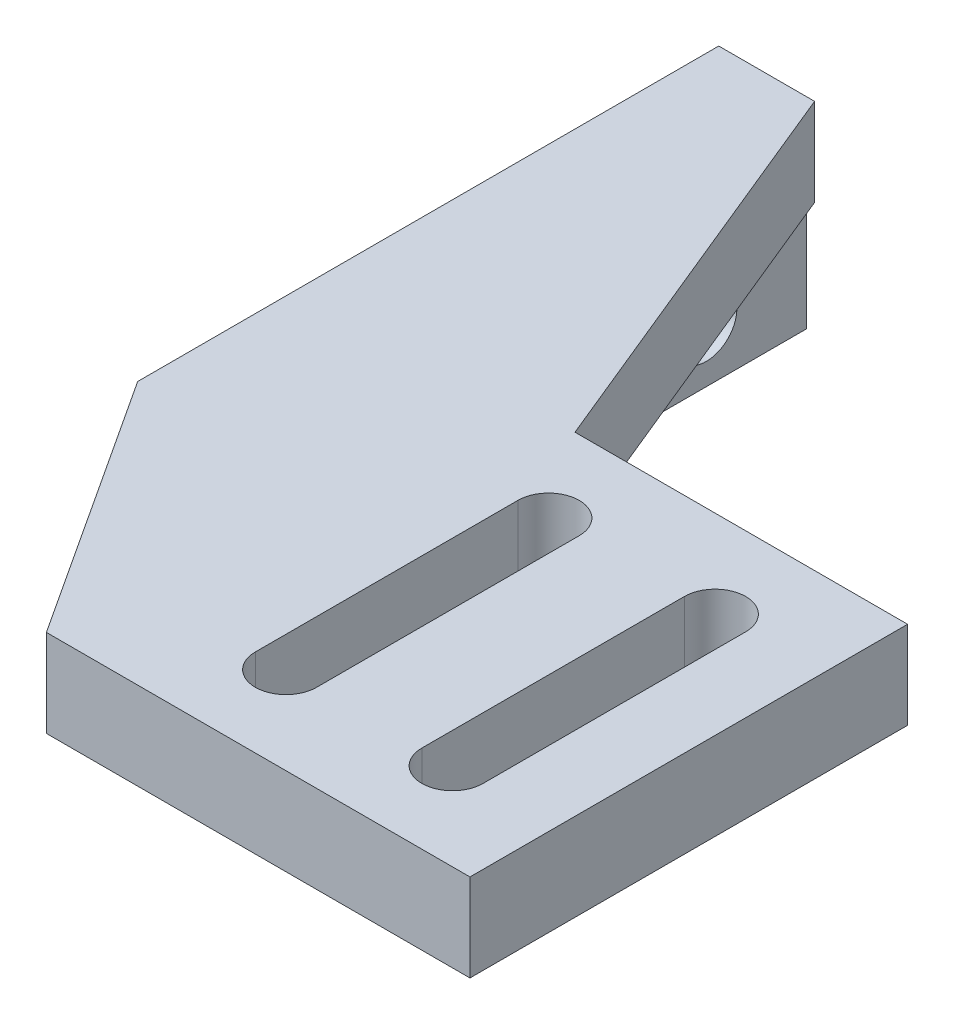
from build123d import *

# Parameters (mm, degrees)
ESTRUSIONE_ESTRUSIONE8_DEPTH = 5
SCHIZZO19_W                  = 5
SCHIZZO19_H                  = 48.212351189
ESTRUSIONE_ESTRUSIONE9_DEPTH = 6.5
SCHIZZO20_R                  = 1.75
TAGLIO_ESTRUSIONE9_DEPTH     = 6
TAGLIO_ESTRUSIONE13_DEPTH    = 21
SCHIZZO26_W                  = 5
SCHIZZO26_H                  = 6.5
TAGLIO_ESTRUSIONE15_DEPTH    = 21
RACCORDO1_R                  = 4


with BuildPart() as part:
    # Schizzo18 → Estrusione-Estrusione8 (new body)
    with BuildSketch(Plane(origin=(0, 40, 0), x_dir=(1, 0, 0), z_dir=(0, 1, 0))):
        Polygon((25, -16), (-9, -16), (-9, 32.212351189), (-3.52472969, 32.212351189), (6, 9), (25, 9), align=None)
        with BuildLine():
            Line((17.25, -11), (17.25, 4))
            ThreePointArc((17.25, 4), (19, 5.75), (20.75, 4))
            Line((20.75, 4), (20.75, -11))
            ThreePointArc((20.75, -11), (19, -12.75), (17.25, -11))
        make_face(mode=Mode.SUBTRACT)
        with BuildLine():
            Line((7.74056589, -11), (7.74056589, 4))
            ThreePointArc((7.74056589, 4), (9.49056589, 5.75), (11.24056589, 4))
            Line((11.24056589, 4), (11.24056589, -11))
            ThreePointArc((11.24056589, -11), (9.49056589, -12.75), (7.74056589, -11))
        make_face(mode=Mode.SUBTRACT)
    extrude(amount=ESTRUSIONE_ESTRUSIONE8_DEPTH)

    # Schizzo19 → Estrusione-Estrusione9 (add)
    with BuildSketch(Plane.XZ.offset(-40)):
        with Locations((-6.5, -8.106175595)):
            Rectangle(SCHIZZO19_W, SCHIZZO19_H)
    extrude(amount=ESTRUSIONE_ESTRUSIONE9_DEPTH)

    # Schizzo20 → Taglio-Estrusione9 (cut)
    with BuildSketch(Plane.ZY.offset(9)):
        with Locations((-26.5, 36.5)):
            Circle(SCHIZZO20_R)
        with Locations((-16.5, 36.5)):
            Circle(SCHIZZO20_R)
    extrude(amount=-TAGLIO_ESTRUSIONE9_DEPTH, mode=Mode.SUBTRACT)

    # Schizzo24 → Taglio-Estrusione13 (cut)
    with BuildSketch(Plane(origin=(0, 45, 0), x_dir=(1, 0, 0), z_dir=(0, 1, 0))):
        Polygon((0.805132443, -16), (-9, -0.979024983), (-9, -16), align=None)
    extrude(amount=-TAGLIO_ESTRUSIONE13_DEPTH, mode=Mode.SUBTRACT)

    # Schizzo26 → Taglio-Estrusione15 (cut)
    with BuildSketch(Plane.XY.offset(0.979024983)):
        with Locations((-6.5, 36.75)):
            Rectangle(SCHIZZO26_W, SCHIZZO26_H)
    extrude(amount=TAGLIO_ESTRUSIONE15_DEPTH, mode=Mode.SUBTRACT)

    # Raccordo1
    raccordo1_edges = [part.edges().sort_by_distance(p)[0] for p in [
        (-6.5, 33.5, 0.979024983),
    ]]
    fillet(raccordo1_edges, radius=RACCORDO1_R)


solid = part.part
